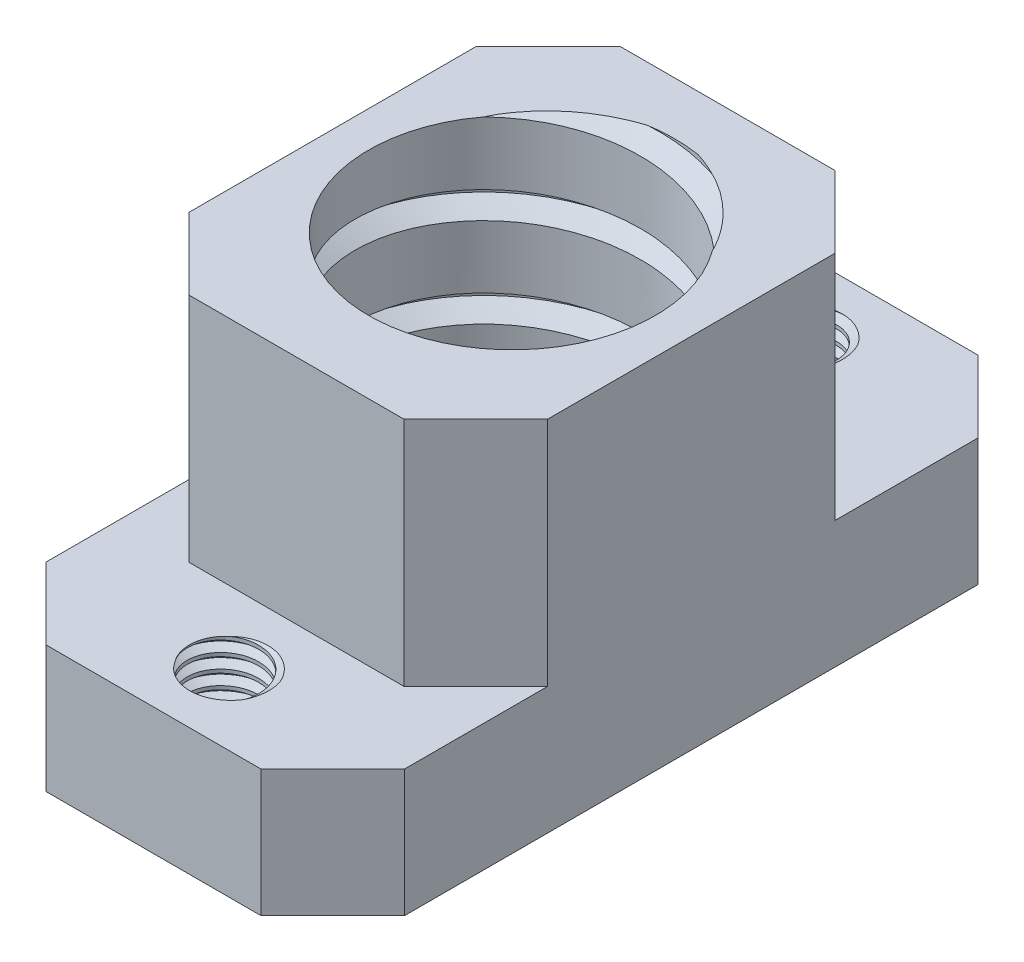
from build123d import *

# Parameters (mm, degrees)
SKETCH1_W                = 10
SKETCH1_H                = 20
SKETCH1_R                = 4
BOSS_EXTRUDE1_DEPTH      = 10
CHAMFER1_SIZE            = 2
SKETCH2_W                = 5.060680384
SKETCH2_H                = 6.456385208
CUT_EXTRUDE1_DEPTH       = 10
CHAMFER2_SIZE            = 2
CHAMFER2_OF_MIRROR1_SIZE = 2
THREAD1_PITCH            = 2.5
SKETCH10_R               = 1
CUT_EXTRUDE2_DEPTH       = 3.543614792
THREAD2_PITCH            = 0.4


with BuildPart() as part:
    # Sketch1 → Boss-Extrude1 (new body)
    with BuildSketch(Plane(origin=(0, 0, 0), x_dir=(1, 0, 0), z_dir=(0, 1, 0))):
        with Locations((0.907090465, -6.644254279)):
            Rectangle(SKETCH1_W, SKETCH1_H)
        with Locations(Location((0.907090465, -6.644254279, 0), (0, 0, 270))):
            Circle(SKETCH1_R, mode=Mode.SUBTRACT)
    extrude(amount=BOSS_EXTRUDE1_DEPTH)

    # Chamfer1
    chamfer1_edges = [part.edges().sort_by_distance(p)[0] for p in [
        (-4.092909535, 5, -3.355745721),
        (5.907090465, 5, -3.355745721),
        (5.907090465, 5, 16.644254279),
        (-4.092909535, 5, 16.644254279),
    ]]
    chamfer(chamfer1_edges, length=CHAMFER1_SIZE)

    # Sketch2 → Cut-Extrude1 (cut)
    with BuildSketch(Plane(origin=(5.907090465, 0, 0), x_dir=(0, 0, -1), z_dir=(1, 0, 0))):
        with Locations((1.896452572, 6.771807396)):
            Rectangle(SKETCH2_W, SKETCH2_H)
    cut_extrude1 = extrude(amount=-CUT_EXTRUDE1_DEPTH, mode=Mode.SUBTRACT)

    # Chamfer2
    chamfer2_edges = [part.edges().sort_by_distance(p)[0] for p in [
        (-4.092909535, 6.771807396, 0.63388762),
        (5.907090465, 6.771807396, 0.63388762),
    ]]
    chamfer(chamfer2_edges, length=CHAMFER2_SIZE)

    # Mirror1: Cut-Extrude1 across plane
    add(cut_extrude1.mirror(Plane.XY.offset(6.644254279)), mode=Mode.SUBTRACT)

    # Chamfer2 of Mirror1
    chamfer2_of_mirror1_edges = [part.edges().sort_by_distance(p)[0] for p in [
        (-4.092909535, 6.771807396, 12.654620938),
        (5.907090465, 6.771807396, 12.654620938),
    ]]
    chamfer(chamfer2_of_mirror1_edges, length=CHAMFER2_OF_MIRROR1_SIZE)

    # Thread1: the profile of Thread Profile1 profile screwed along a right-hand helix of 4.4 turns, 10 arcs to a turn; built about Z, then put on its axis
    thread1_z = Axis((0, 0, 0), (0, 0, 1))
    thread1_corners = [(3.9997, 0, -0.000173205), (4.541265875, 0, 0.312499999), (4.541265875, 0, 0.437499999), (3.9997, 0, 0.750173202)]
    with BuildLine(mode=Mode.PRIVATE) as thread1_profile:
        Line(thread1_corners[0], thread1_corners[1])
        Line(thread1_corners[1], thread1_corners[2])
        Line(thread1_corners[2], thread1_corners[3])
        Line(thread1_corners[3], thread1_corners[0])
    thread1_cap = Face(thread1_profile.wire())
    thread1_turn_angles = [0, 18, 36, 54, 72, 90, 108, 126, 144, 162, 180, 198, 216, 234, 252, 270, 288, 306, 324, 342, 360]
    thread1_turn_weights = [1, 0.9510565162951535, 1, 0.9510565162951535, 1, 0.9510565162951535, 1, 0.9510565162951535, 1, 0.9510565162951535, 1, 0.9510565162951535, 1, 0.9510565162951535, 1, 0.9510565162951535, 1, 0.9510565162951535, 1, 0.9510565162951535, 1]
    thread1_turn_rails = [Edge.make_bspline([Vector(p[0], p[1], 0).rotate(thread1_z, thread1_turn_angles[k]) / thread1_turn_weights[k] + Vector(0, 0, p[2] + THREAD1_PITCH * thread1_turn_angles[k] / 360) for k in range(21)], [0, 0, 0, 1, 1, 2, 2, 3, 3, 4, 4, 5, 5, 6, 6, 7, 7, 8, 8, 9, 9, 10, 10, 10], 2, thread1_turn_weights) for p in thread1_corners]
    thread1_turn_sides = [Face.make_surface_from_curves(thread1_turn_rails[p[0]], thread1_turn_rails[p[1]]) for p in [(0, 1), (1, 2), (2, 3), (3, 0)]]
    thread1_last_angles = [1440, 1458, 1476, 1494, 1512, 1530, 1548, 1566, 1584]
    thread1_last_weights = [1, 0.9510565162951535, 1, 0.9510565162951535, 1, 0.9510565162951535, 1, 0.9510565162951535, 1]
    thread1_last_rails = [Edge.make_bspline([Vector(p[0], p[1], 0).rotate(thread1_z, thread1_last_angles[k]) / thread1_last_weights[k] + Vector(0, 0, p[2] + THREAD1_PITCH * thread1_last_angles[k] / 360) for k in range(9)], [0, 0, 0, 1, 1, 2, 2, 3, 3, 4, 4, 4], 2, thread1_last_weights) for p in thread1_corners]
    thread1_last_sides = [Face.make_surface_from_curves(thread1_last_rails[p[0]], thread1_last_rails[p[1]]) for p in [(0, 1), (1, 2), (2, 3), (3, 0)]]
    thread1 = Plane(origin=(0.907090465, -1, 6.644254279), x_dir=(1, 0, 0), z_dir=(0, 1, 0)) * Solid(Shell([*[p.moved(Location((0, 0, THREAD1_PITCH * i))) for i in range(4) for p in thread1_turn_sides], *thread1_last_sides, thread1_cap, thread1_cap.rotate(thread1_z, 1584).moved(Location((0, 0, THREAD1_PITCH * 1584 / 360)))]))
    add(thread1, mode=Mode.SUBTRACT)

    # Sketch10 → Cut-Extrude2 (cut)
    with BuildSketch(Plane(origin=(0, 3.543614792, 0), x_dir=(1, 0, 0), z_dir=(0, 1, 0))):
        with Locations(Location((0.907090465, -14.644254279, 0), (0, 0, 270))):
            Circle(SKETCH10_R)
    cut_extrude2 = extrude(amount=-CUT_EXTRUDE2_DEPTH, mode=Mode.SUBTRACT)

    # Thread2: the profile of Thread Profile2 profile screwed along a right-hand helix of 11.359037 turns, 6 arcs to a turn; built about Z, then put on its axis
    thread2_z = Axis((0, 0, 0), (0, 0, 1))
    thread2_corners = [(0.9997, 0, -0.000173205), (1.21650635, 0, 0.124999999), (1.21650635, 0, 0.174999999), (0.9997, 0, 0.300173204)]
    with BuildLine(mode=Mode.PRIVATE) as thread2_profile:
        Line(thread2_corners[0], thread2_corners[1])
        Line(thread2_corners[1], thread2_corners[2])
        Line(thread2_corners[2], thread2_corners[3])
        Line(thread2_corners[3], thread2_corners[0])
    thread2_cap = Face(thread2_profile.wire())
    thread2_turn_angles = [0, 30, 60, 90, 120, 150, 180, 210, 240, 270, 300, 330, 360]
    thread2_turn_weights = [1, 0.8660254037844387, 1, 0.8660254037844387, 1, 0.8660254037844387, 1, 0.8660254037844387, 1, 0.8660254037844387, 1, 0.8660254037844387, 1]
    thread2_turn_rails = [Edge.make_bspline([Vector(p[0], p[1], 0).rotate(thread2_z, thread2_turn_angles[k]) / thread2_turn_weights[k] + Vector(0, 0, p[2] + THREAD2_PITCH * thread2_turn_angles[k] / 360) for k in range(13)], [0, 0, 0, 1, 1, 2, 2, 3, 3, 4, 4, 5, 5, 6, 6, 6], 2, thread2_turn_weights) for p in thread2_corners]
    thread2_turn_sides = [Face.make_surface_from_curves(thread2_turn_rails[p[0]], thread2_turn_rails[p[1]]) for p in [(0, 1), (1, 2), (2, 3), (3, 0)]]
    thread2_last_angles = [3960, 3990, 4020, 4050, 4080, 4084.626656612, 4089.253313224]
    thread2_last_weights = [1, 0.8660254037844387, 1, 0.8660254037844387, 1, 0.9967414583790685, 1]
    thread2_last_rails = [Edge.make_bspline([Vector(p[0], p[1], 0).rotate(thread2_z, thread2_last_angles[k]) / thread2_last_weights[k] + Vector(0, 0, p[2] + THREAD2_PITCH * thread2_last_angles[k] / 360) for k in range(7)], [0, 0, 0, 1, 1, 2, 2, 3, 3, 3], 2, thread2_last_weights) for p in thread2_corners]
    thread2_last_sides = [Face.make_surface_from_curves(thread2_last_rails[p[0]], thread2_last_rails[p[1]]) for p in [(0, 1), (1, 2), (2, 3), (3, 0)]]
    thread2 = Plane(origin=(0.907090465, -1, 14.644254279), x_dir=(1, 0, 0), z_dir=(0, 1, 0)) * Solid(Shell([*[p.moved(Location((0, 0, THREAD2_PITCH * i))) for i in range(11) for p in thread2_turn_sides], *thread2_last_sides, thread2_cap, thread2_cap.rotate(thread2_z, 4089.253313224).moved(Location((0, 0, THREAD2_PITCH * 4089.253313224 / 360)))]))
    add(thread2, mode=Mode.SUBTRACT)

    # Mirror2: Cut-Extrude2, Thread2 across plane
    add(cut_extrude2.mirror(Plane.XY.offset(6.644254279)), mode=Mode.SUBTRACT)
    add(thread2.mirror(Plane.XY.offset(6.644254279)), mode=Mode.SUBTRACT)


solid = part.part
